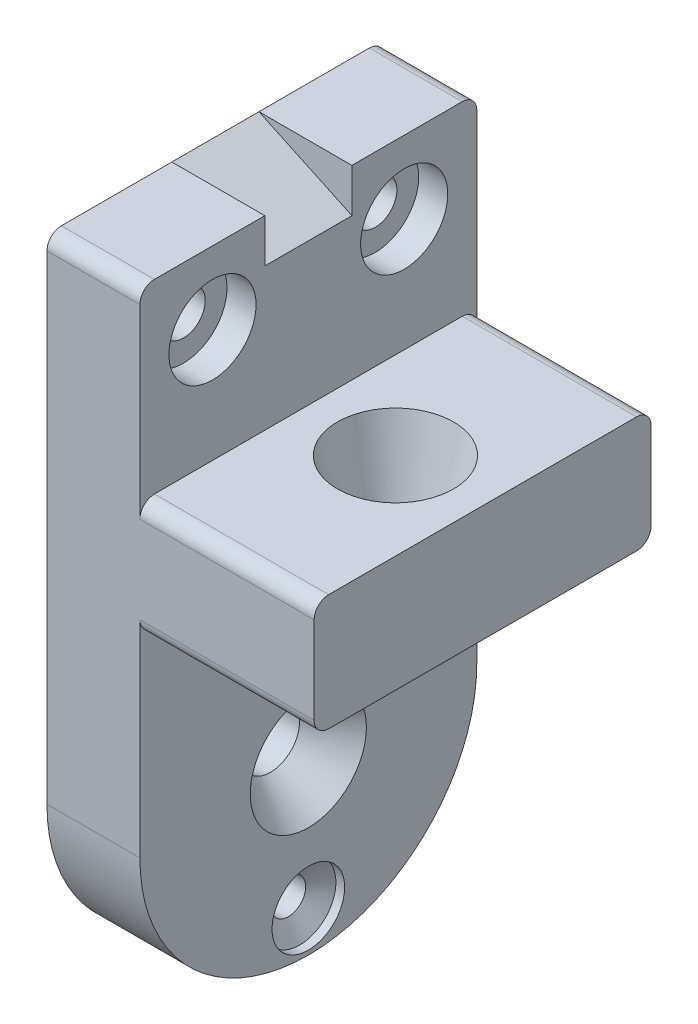
from build123d import *

# Parameters (mm, degrees)
SALIENTE_EXTRUIR3_DEPTH                              = 116
REDONDEO1_R                                          = 5
REDONDEO2_R                                          = 58
REFRENTADO_PARA_TORNILLO_CON_CABEZA_PLAN_D           = 15
REFRENTADO_PARA_TORNILLO_CON_CABEZA_PLAN_CBORE_D     = 30
REFRENTADO_PARA_TORNILLO_CON_CABEZA_PLAN_CBORE_DEPTH = 10
AVELLANADO_PARA_TORNILLO_CON_CABEZA_PLAN_D           = 20
AVELLANADO_PARA_TORNILLO_CON_CABEZA_PLAN_CSINK_D     = 40
AVELLANADO_PARA_TORNILLO_CON_CABEZA_PLAN_CSINK_ANGLE = 75
CORTAR_EXTRUIR1_DEPTH                                = 15


with BuildPart() as part:
    # Croquis1 → Saliente-Extruir3 (new body)
    with BuildSketch(Plane.XY):
        Polygon((0, 164), (0, 228), (-32, 228), (-32, 0), (0, 0), (0, 124), (60, 124), (60, 164), align=None)
    extrude(amount=-SALIENTE_EXTRUIR3_DEPTH)

    # Redondeo1
    redondeo1_edges = [part.edges().sort_by_distance(p)[0] for p in [
        (30, 164, 0),
        (30, 124, 0),
        (30, 164, -116),
        (-16, 228, -116),
        (30, 124, -116),
        (-16, 228, 0),
    ]]
    fillet(redondeo1_edges, radius=REDONDEO1_R)

    # Redondeo2
    redondeo2_edges = [part.edges().sort_by_distance(p)[0] for p in [
        (-16, 0, -116),
        (-16, 0, 0),
    ]]
    fillet(redondeo2_edges, radius=REDONDEO2_R - 0.0001)  # a hair under: the kernel refuses the full size

    # Refrentado para tornillo con cabeza plana de M51 (through all)
    with Locations(Plane(origin=(0, 203, -25), x_dir=(0, 0, 1), z_dir=(1, 0, 0))):
        with Locations((0, 0), (-66, 0)):
            CounterBoreHole(REFRENTADO_PARA_TORNILLO_CON_CABEZA_PLAN_D / 2, REFRENTADO_PARA_TORNILLO_CON_CABEZA_PLAN_CBORE_D / 2, REFRENTADO_PARA_TORNILLO_CON_CABEZA_PLAN_CBORE_DEPTH)

    # Avellanado para tornillo con cabeza plana avellanada de M51 (through all)
    with Locations(Plane(origin=(0, 58, -58), x_dir=(0, 0, 1), z_dir=(1, 0, 0))):
        with Locations((0, 0)):
            CounterSinkHole(AVELLANADO_PARA_TORNILLO_CON_CABEZA_PLAN_D / 2, AVELLANADO_PARA_TORNILLO_CON_CABEZA_PLAN_CSINK_D / 2, counter_sink_angle=AVELLANADO_PARA_TORNILLO_CON_CABEZA_PLAN_CSINK_ANGLE)

    # Croquis6 → Taladro1 (revolve, cut)
    with BuildSketch(Plane(origin=(0, 14, -58), x_dir=(0, 0, -1), z_dir=(0, 1, 0))):
        Polygon((0, 0), (0, 27.819352237), (6, 20), (6, 6.905594024), (12.5, 3), (12.5, 0), align=None)
    revolve(axis=Axis((6.130023899, 14, -58), (-1, 0, 0)), mode=Mode.SUBTRACT)

    # Croquis9 → Taladro2 (revolve, cut)
    with BuildSketch(Plane(origin=(30, 164, -58), x_dir=(0, 0, 1), z_dir=(1, 0, 0))):
        Polygon((0, 0), (0, 40), (10, 40), (20, 0), align=None)
    revolve(axis=Axis((30, 54, -58), (0, 1, 0)), mode=Mode.SUBTRACT)

    # Croquis10 → Cortar-Extruir1 (cut, symmetric)
    with BuildSketch(Plane.XY.offset(-58)):
        Polygon((-32, 228), (0, 228), (0, 213), align=None)
    extrude(amount=CORTAR_EXTRUIR1_DEPTH, both=True, mode=Mode.SUBTRACT)


solid = part.part
